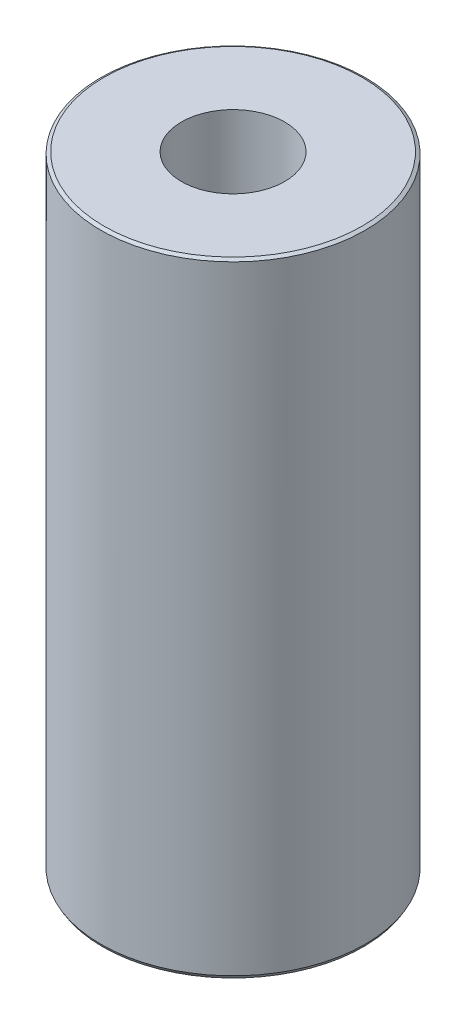
from build123d import *
from OCP.BRepFilletAPI import BRepFilletAPI_MakeChamfer

# Parameters (mm, degrees)
SKETCH1_R           = 25
BOSS_EXTRUDE1_DEPTH = 117.85406608
SKETCH2_R           = 9.761734918
CUT_EXTRUDE1_DEPTH  = 124.043004237
CHAMFER1_SIZE       = 0.354963701
CHAMFER1_SIZE2      = 0.614815164


with BuildPart() as part:
    # Sketch1 → Boss-Extrude1 (new body)
    with BuildSketch(Plane(origin=(0, 0, 0), x_dir=(1, 0, 0), z_dir=(0, 1, 0))):
        Circle(SKETCH1_R)
    extrude(amount=BOSS_EXTRUDE1_DEPTH)

    # Sketch2 → Cut-Extrude1 (cut, through all)
    with BuildSketch(Plane(origin=(0, 0, 0), x_dir=(1, 0, 0), z_dir=(0, 1, 0))):
        Circle(SKETCH2_R)
    extrude(amount=CUT_EXTRUDE1_DEPTH, mode=Mode.SUBTRACT)

    # Chamfer1: one chamfer whose edges measure the first distance from different faces: ONE call of the kernel's chamfer builder (chamfer() names one face for all edges)
    chamfer1_edges_1 = [part.edges().sort_by_distance(p)[0] for p in [
        (-25, 117.85406608, 0),
    ]]
    chamfer1_side_1 = [part.faces().sort_by_distance(p)[0] for p in [
        (-25, 58.92703304, 0),
    ]]
    chamfer1_edges_2 = [part.edges().sort_by_distance(p)[0] for p in [
        (-25, 0, 0),
    ]]
    chamfer1_side_2 = [part.faces().sort_by_distance(p)[0] for p in [
        (-24.292893219, 0, 0),
    ]]
    chamfer1 = BRepFilletAPI_MakeChamfer(part.part.solid().wrapped)
    for e in chamfer1_edges_1:
        chamfer1.Add(CHAMFER1_SIZE, CHAMFER1_SIZE2, e.wrapped, chamfer1_side_1[0].wrapped)  # the first distance lies on this face
    for e in chamfer1_edges_2:
        chamfer1.Add(CHAMFER1_SIZE, CHAMFER1_SIZE2, e.wrapped, chamfer1_side_2[0].wrapped)  # the first distance lies on this face
    add(Compound.cast(chamfer1.Shape()), mode=Mode.REPLACE)


solid = part.part
